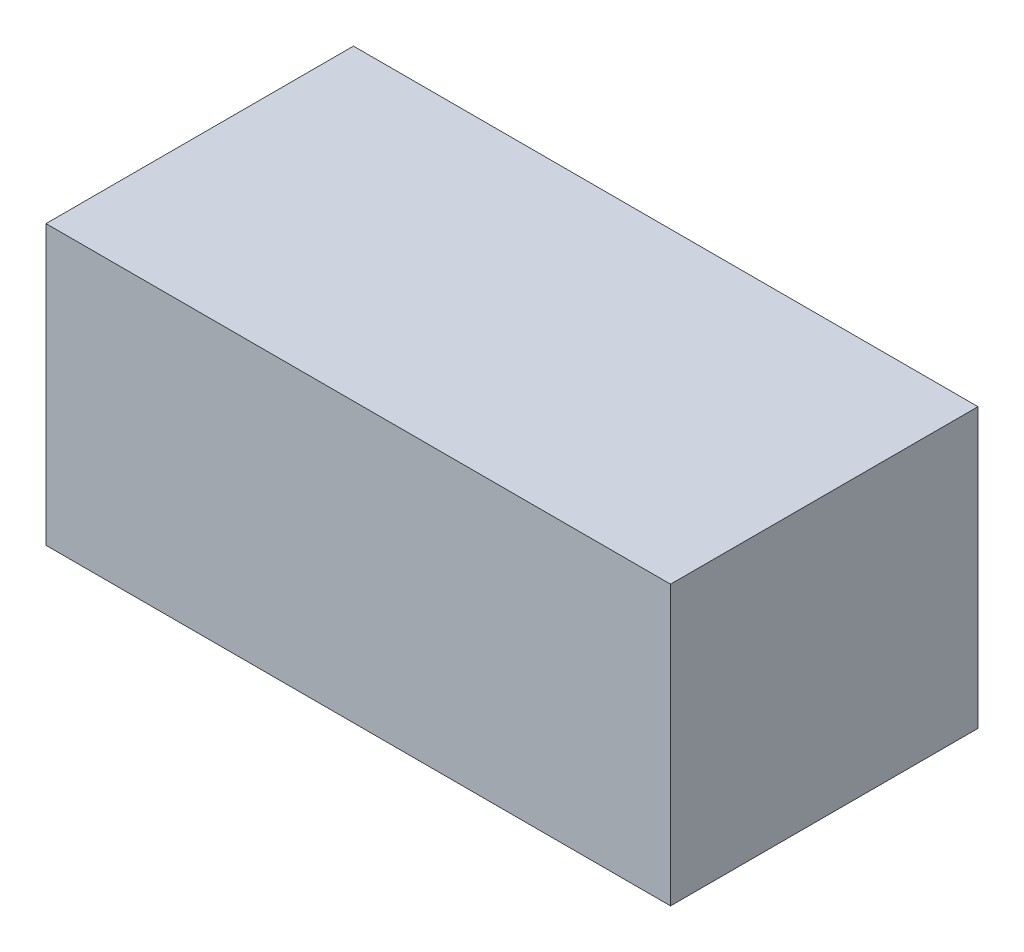
from build123d import *

# Parameters (mm, degrees)
SKETCH1_W           = 65
SKETCH1_H           = 32
BOSS_EXTRUDE1_DEPTH = 14.5


with BuildPart() as part:
    # Sketch1 → Boss-Extrude1 (new, symmetric)
    with BuildSketch(Plane(origin=(0, 0, 0), x_dir=(1, 0, 0), z_dir=(0, 1, 0))):
        Rectangle(SKETCH1_W, SKETCH1_H)
    extrude(amount=BOSS_EXTRUDE1_DEPTH, both=True)


solid = part.part
